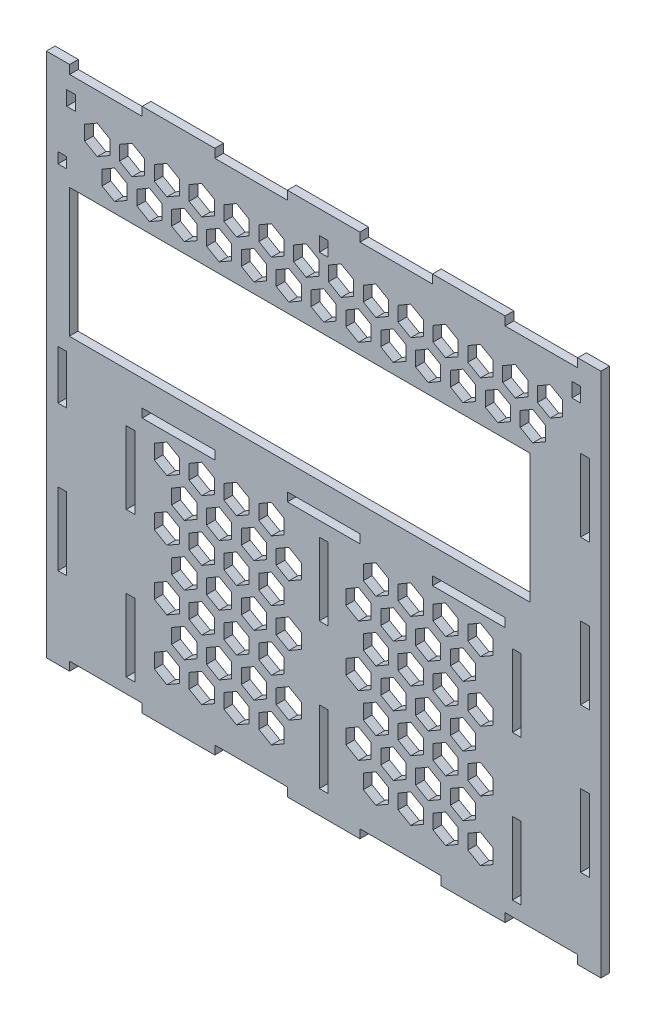
from build123d import *

# Parameters (mm, degrees)
SKICA1_W                      = 191
SKICA1_H                      = 175
P_IDAT_VYSUNUT_M1_DEPTH       = 3
SKICA2_W                      = 8
SKICA2_H                      = 3
SKICA2_W_2                    = 25
P_IDAT_VYSUNUT_M2_DEPTH       = 3
SKICA3_W                      = 3
SKICA3_H                      = 25
ODEBRAT_VYSUNUT_M1_DEPTH      = 132.60357138
SKICA4_W                      = 25
SKICA4_H                      = 3
ODEBRAT_VYSUNUT_M2_DEPTH      = 132.60357138
SKICA5_W                      = 158.75
SKICA5_H                      = 44.45
ODEBRAT_VYSUNUT_M3_DEPTH      = 132.60357138
SKICA8_W                      = 3
SKICA8_H                      = 5
ODEBRAT_VYSUNUT_M5_DEPTH      = 132.60357138
SKICA9_W                      = 3
SKICA9_H                      = 25
ODEBRAT_VYSUNUT_M6_DEPTH      = 132.60357138
SKICA10_W                     = 63.5
SKICA10_H                     = 80
P_IDAT_VYSUNUT_M3_DEPTH       = 10
POLE_VYPLN_N_M1_DEPTH         = 13
ODEBRAT_VYSUNUT_M7_DEPTH      = 133.210060132
ODEBRAT_VYSUNUT_M7_DEPTH_BACK = 133.210060132
SKICA11_W                     = 274.944841585
SKICA11_H                     = 28.480117971
SKICA12_W                     = 3
SKICA12_H                     = 21.33
SKICA12_H_2                   = 8.12
P_IDAT_VYSUNUT_M4_DEPTH       = 3
SKICA13_W                     = 3
SKICA13_H                     = 3
ODEBRAT_VYSUNUT_M8_DEPTH      = 132.60357138


# Read off the part's stored shape, not the designer's step: Pole vyplněním1
with BuildPart() as part:
    # Skica1 → Přidat vysunutím1 (new body)
    with BuildSketch(Plane.XY):
        Rectangle(SKICA1_W, SKICA1_H)
    extrude(amount=P_IDAT_VYSUNUT_M1_DEPTH)

    # Skica2 → Přidat vysunutím2 (add)
    with BuildSketch(Plane.XY):
        with Locations((-91.5, -89)):
            Rectangle(SKICA2_W, SKICA2_H)
        with Locations((-50, -89)):
            Rectangle(SKICA2_W_2, SKICA2_H)
        with Locations((0, -89)):
            Rectangle(SKICA2_W_2, SKICA2_H)
        with Locations((50, -89)):
            Rectangle(SKICA2_W_2, SKICA2_H)
        with Locations((91.5, -89)):
            Rectangle(SKICA2_W, SKICA2_H)
        with Locations((91.5, 89)):
            Rectangle(SKICA2_W, SKICA2_H)
        with Locations((50, 89)):
            Rectangle(SKICA2_W_2, SKICA2_H)
        with Locations((0, 89)):
            Rectangle(SKICA2_W_2, SKICA2_H)
        with Locations((-50, 89)):
            Rectangle(SKICA2_W_2, SKICA2_H)
        with Locations((-91.5, 89)):
            Rectangle(SKICA2_W, SKICA2_H)
    extrude(amount=P_IDAT_VYSUNUT_M2_DEPTH)

    # Skica3 → Odebrat vysunutím1 (cut, through all)
    with BuildSketch(Plane.XY):
        with Locations((0, -70)):
            Rectangle(SKICA3_W, SKICA3_H)
        with Locations((-66.5, -70)):
            Rectangle(SKICA3_W, SKICA3_H)
        with Locations((66.5, -70)):
            Rectangle(SKICA3_W, SKICA3_H)
        with Locations((0, -20)):
            Rectangle(SKICA3_W, SKICA3_H)
        with Locations((-66.5, -20)):
            Rectangle(SKICA3_W, SKICA3_H)
        with Locations((66.5, -20)):
            Rectangle(SKICA3_W, SKICA3_H)
    extrude(amount=ODEBRAT_VYSUNUT_M1_DEPTH, mode=Mode.SUBTRACT)

    # Skica4 → Odebrat vysunutím2 (cut, through all)
    with BuildSketch(Plane.XY):
        with Locations((-50, -1)):
            Rectangle(SKICA4_W, SKICA4_H)
        with Locations((0, -1)):
            Rectangle(SKICA4_W, SKICA4_H)
        with Locations((50, -1)):
            Rectangle(SKICA4_W, SKICA4_H)
    extrude(amount=ODEBRAT_VYSUNUT_M2_DEPTH, mode=Mode.SUBTRACT)

    # Skica5 → Odebrat vysunutím3 (cut, through all)
    with BuildSketch(Plane.XY):
        with Locations((-8.245, 31.605)):
            Rectangle(SKICA5_W, SKICA5_H)
    extrude(amount=ODEBRAT_VYSUNUT_M3_DEPTH, mode=Mode.SUBTRACT)

    # Skica8 → Odebrat vysunutím5 (cut, through all)
    with BuildSketch(Plane.XY):
        with Locations((-87, 80)):
            Rectangle(SKICA8_W, SKICA8_H)
        with Locations((0, 80)):
            Rectangle(SKICA8_W, SKICA8_H)
        with Locations((87, 80)):
            Rectangle(SKICA8_W, SKICA8_H)
    extrude(amount=ODEBRAT_VYSUNUT_M5_DEPTH, mode=Mode.SUBTRACT)

    # Skica9 → Odebrat vysunutím6 (cut, through all)
    with BuildSketch(Plane.XY):
        with Locations((-90, 50)):
            Rectangle(SKICA9_W, SKICA9_H)
        with Locations((-90, 0)):
            Rectangle(SKICA9_W, SKICA9_H)
        with Locations((-90, -50)):
            Rectangle(SKICA9_W, SKICA9_H)
        with Locations((90, -50)):
            Rectangle(SKICA9_W, SKICA9_H)
        with Locations((90, 0)):
            Rectangle(SKICA9_W, SKICA9_H)
        with Locations((90, 50)):
            Rectangle(SKICA9_W, SKICA9_H)
    extrude(amount=ODEBRAT_VYSUNUT_M6_DEPTH, mode=Mode.SUBTRACT)

    # Skica10 → Přidat vysunutím3 (add)
    with BuildSketch(Plane.XY.offset(3)):
        with Locations((-33.25, -42.5)):
            Rectangle(SKICA10_W, SKICA10_H)
        with Locations((33.25, -42.5)):
            Rectangle(SKICA10_W, SKICA10_H)
        Polygon((-85.5, 82.5), (-1.5, 82.5), (-1.5, 77.5), (1.5, 77.5), (1.5, 82.5), (85.5, 82.5), (85.5, 53.83), (-85.5, 53.83), align=None)
    extrude(amount=P_IDAT_VYSUNUT_M3_DEPTH)

    # Pole vyplněním1 outline → Pole vyplněním1 (cut)
    with BuildSketch(Plane.XY):
        Polygon((-73.669872981, 75.246133918), (-78, 77.746133918), (-82.330127019, 75.246133918), (-82.330127019, 70.246133918), (-78, 67.746133918), (-73.669872981, 70.246133918), align=None)
        Polygon((-55.669872981, 64.853829072), (-60, 67.353829072), (-64.330127019, 64.853829072), (-64.330127019, 59.853829072), (-60, 57.353829072), (-55.669872981, 59.853829072), align=None)
        Polygon((-67.669872981, 64.853829072), (-72, 67.353829072), (-76.330127019, 64.853829072), (-76.330127019, 59.853829072), (-72, 57.353829072), (-67.669872981, 59.853829072), align=None)
        Polygon((58.330127019, -7.892304845), (54, -5.392304845), (49.669872981, -7.892304845), (49.669872981, -12.892304845), (54, -15.392304845), (58.330127019, -12.892304845), align=None)
        Polygon((-54, 77.746133918), (-58.330127019, 75.246133918), (-58.330127019, 70.246133918), (-54, 67.746133918), (-49.669872981, 70.246133918), (-49.669872981, 75.246133918), align=None)
        Polygon((-42, 77.746133918), (-46.330127019, 75.246133918), (-46.330127019, 70.246133918), (-42, 67.746133918), (-37.669872981, 70.246133918), (-37.669872981, 75.246133918), align=None)
        Polygon((-43.669872981, 64.853829072), (-48, 67.353829072), (-52.330127019, 64.853829072), (-52.330127019, 59.853829072), (-48, 57.353829072), (-43.669872981, 59.853829072), align=None)
        Polygon((-61.669872981, 75.246133918), (-66, 77.746133918), (-70.330127019, 75.246133918), (-70.330127019, 70.246133918), (-66, 67.746133918), (-61.669872981, 70.246133918), align=None)
        Polygon((-30, 77.746133918), (-34.330127019, 75.246133918), (-34.330127019, 70.246133918), (-30, 67.746133918), (-25.669872981, 70.246133918), (-25.669872981, 75.246133918), align=None)
        Polygon((-52.330127019, -59.853829072), (-52.330127019, -64.853829072), (-48, -67.353829072), (-43.669872981, -64.853829072), (-43.669872981, -59.853829072), (-48, -57.353829072), align=None)
        Polygon((-52.330127019, -18.284609691), (-52.330127019, -23.284609691), (-48, -25.784609691), (-43.669872981, -23.284609691), (-43.669872981, -18.284609691), (-48, -15.784609691), align=None)
        Polygon((-52.330127019, -39.069219382), (-52.330127019, -44.069219382), (-48, -46.569219382), (-43.669872981, -44.069219382), (-43.669872981, -39.069219382), (-48, -36.569219382), align=None)
        Polygon((-31.669872981, 64.853829072), (-36, 67.353829072), (-40.330127019, 64.853829072), (-40.330127019, 59.853829072), (-36, 57.353829072), (-31.669872981, 59.853829072), align=None)
        Polygon((-18, 77.746133918), (-22.330127019, 75.246133918), (-22.330127019, 70.246133918), (-18, 67.746133918), (-13.669872981, 70.246133918), (-13.669872981, 75.246133918), align=None)
        Polygon((-40.330127019, -59.853829072), (-40.330127019, -64.853829072), (-36, -67.353829072), (-31.669872981, -64.853829072), (-31.669872981, -59.853829072), (-36, -57.353829072), align=None)
        Polygon((-40.330127019, -39.069219382), (-40.330127019, -44.069219382), (-36, -46.569219382), (-31.669872981, -44.069219382), (-31.669872981, -39.069219382), (-36, -36.569219382), align=None)
        Polygon((-40.330127019, -18.284609691), (-40.330127019, -23.284609691), (-36, -25.784609691), (-31.669872981, -23.284609691), (-31.669872981, -18.284609691), (-36, -15.784609691), align=None)
        Polygon((-49.669872981, -70.246133918), (-54, -67.746133918), (-58.330127019, -70.246133918), (-58.330127019, -75.246133918), (-54, -77.746133918), (-49.669872981, -75.246133918), align=None)
        Polygon((-18, -46.961524227), (-22.330127019, -49.461524227), (-22.330127019, -54.461524227), (-18, -56.961524227), (-13.669872981, -54.461524227), (-13.669872981, -49.461524227), align=None)
        Polygon((18, -26.176914536), (13.669872981, -28.676914536), (13.669872981, -33.676914536), (18, -36.176914536), (22.330127019, -33.676914536), (22.330127019, -28.676914536), align=None)
        Polygon((36, -15.784609691), (31.669872981, -18.284609691), (31.669872981, -23.284609691), (36, -25.784609691), (40.330127019, -23.284609691), (40.330127019, -18.284609691), align=None)
        Polygon((-58.330127019, -7.892304845), (-58.330127019, -12.892304845), (-54, -15.392304845), (-49.669872981, -12.892304845), (-49.669872981, -7.892304845), (-54, -5.392304845), align=None)
        Polygon((-58.330127019, -28.676914536), (-58.330127019, -33.676914536), (-54, -36.176914536), (-49.669872981, -33.676914536), (-49.669872981, -28.676914536), (-54, -26.176914536), align=None)
        Polygon((-58.330127019, -49.461524227), (-58.330127019, -54.461524227), (-54, -56.961524227), (-49.669872981, -54.461524227), (-49.669872981, -49.461524227), (-54, -46.961524227), align=None)
        Polygon((-37.669872981, -70.246133918), (-42, -67.746133918), (-46.330127019, -70.246133918), (-46.330127019, -75.246133918), (-42, -77.746133918), (-37.669872981, -75.246133918), align=None)
        Polygon((-24, -57.353829072), (-28.330127019, -59.853829072), (-28.330127019, -64.853829072), (-24, -67.353829072), (-19.669872981, -64.853829072), (-19.669872981, -59.853829072), align=None)
        Polygon((12, -36.569219382), (7.669872981, -39.069219382), (7.669872981, -44.069219382), (12, -46.569219382), (16.330127019, -44.069219382), (16.330127019, -39.069219382), align=None)
        Polygon((30, -26.176914536), (25.669872981, -28.676914536), (25.669872981, -33.676914536), (30, -36.176914536), (34.330127019, -33.676914536), (34.330127019, -28.676914536), align=None)
        Polygon((48, -15.784609691), (43.669872981, -18.284609691), (43.669872981, -23.284609691), (48, -25.784609691), (52.330127019, -23.284609691), (52.330127019, -18.284609691), align=None)
        Polygon((-46.330127019, -49.461524227), (-46.330127019, -54.461524227), (-42, -56.961524227), (-37.669872981, -54.461524227), (-37.669872981, -49.461524227), (-42, -46.961524227), align=None)
        Polygon((-46.330127019, -7.892304845), (-46.330127019, -12.892304845), (-42, -15.392304845), (-37.669872981, -12.892304845), (-37.669872981, -7.892304845), (-42, -5.392304845), align=None)
        Polygon((-46.330127019, -28.676914536), (-46.330127019, -33.676914536), (-42, -36.176914536), (-37.669872981, -33.676914536), (-37.669872981, -28.676914536), (-42, -26.176914536), align=None)
        Polygon((-25.669872981, -70.246133918), (-30, -67.746133918), (-34.330127019, -70.246133918), (-34.330127019, -75.246133918), (-30, -77.746133918), (-25.669872981, -75.246133918), align=None)
        Polygon((-12, -57.353829072), (-16.330127019, -59.853829072), (-16.330127019, -64.853829072), (-12, -67.353829072), (-7.669872981, -64.853829072), (-7.669872981, -59.853829072), align=None)
        Polygon((24, -36.569219382), (19.669872981, -39.069219382), (19.669872981, -44.069219382), (24, -46.569219382), (28.330127019, -44.069219382), (28.330127019, -39.069219382), align=None)
        Polygon((42, -26.176914536), (37.669872981, -28.676914536), (37.669872981, -33.676914536), (42, -36.176914536), (46.330127019, -33.676914536), (46.330127019, -28.676914536), align=None)
        Polygon((-34.330127019, -49.461524227), (-34.330127019, -54.461524227), (-30, -56.961524227), (-25.669872981, -54.461524227), (-25.669872981, -49.461524227), (-30, -46.961524227), align=None)
        Polygon((-34.330127019, -28.676914536), (-34.330127019, -33.676914536), (-30, -36.176914536), (-25.669872981, -33.676914536), (-25.669872981, -28.676914536), (-30, -26.176914536), align=None)
        Polygon((-34.330127019, -7.892304845), (-34.330127019, -12.892304845), (-30, -15.392304845), (-25.669872981, -12.892304845), (-25.669872981, -7.892304845), (-30, -5.392304845), align=None)
        Polygon((-13.669872981, -70.246133918), (-18, -67.746133918), (-22.330127019, -70.246133918), (-22.330127019, -75.246133918), (-18, -77.746133918), (-13.669872981, -75.246133918), align=None)
        Polygon((18, -46.961524227), (13.669872981, -49.461524227), (13.669872981, -54.461524227), (18, -56.961524227), (22.330127019, -54.461524227), (22.330127019, -49.461524227), align=None)
        Polygon((36, -36.569219382), (31.669872981, -39.069219382), (31.669872981, -44.069219382), (36, -46.569219382), (40.330127019, -44.069219382), (40.330127019, -39.069219382), align=None)
        Polygon((54, -26.176914536), (49.669872981, -28.676914536), (49.669872981, -33.676914536), (54, -36.176914536), (58.330127019, -33.676914536), (58.330127019, -28.676914536), align=None)
        Polygon((-22.330127019, -28.676914536), (-22.330127019, -33.676914536), (-18, -36.176914536), (-13.669872981, -33.676914536), (-13.669872981, -28.676914536), (-18, -26.176914536), align=None)
        Polygon((-22.330127019, -7.892304845), (-22.330127019, -12.892304845), (-18, -15.392304845), (-13.669872981, -12.892304845), (-13.669872981, -7.892304845), (-18, -5.392304845), align=None)
        Polygon((22.330127019, -70.246133918), (18, -67.746133918), (13.669872981, -70.246133918), (13.669872981, -75.246133918), (18, -77.746133918), (22.330127019, -75.246133918), align=None)
        Polygon((36, -57.353829072), (31.669872981, -59.853829072), (31.669872981, -64.853829072), (36, -67.353829072), (40.330127019, -64.853829072), (40.330127019, -59.853829072), align=None)
        Polygon((54, -46.961524227), (49.669872981, -49.461524227), (49.669872981, -54.461524227), (54, -56.961524227), (58.330127019, -54.461524227), (58.330127019, -49.461524227), align=None)
        Polygon((13.669872981, -7.892304845), (13.669872981, -12.892304845), (18, -15.392304845), (22.330127019, -12.892304845), (22.330127019, -7.892304845), (18, -5.392304845), align=None)
        Polygon((13.669872981, 75.246133918), (13.669872981, 70.246133918), (18, 67.746133918), (22.330127019, 70.246133918), (22.330127019, 75.246133918), (18, 77.746133918), align=None)
        Polygon((34.330127019, -70.246133918), (30, -67.746133918), (25.669872981, -70.246133918), (25.669872981, -75.246133918), (30, -77.746133918), (34.330127019, -75.246133918), align=None)
        Polygon((16.330127019, -59.853829072), (12, -57.353829072), (7.669872981, -59.853829072), (7.669872981, -64.853829072), (12, -67.353829072), (16.330127019, -64.853829072), align=None)
        Polygon((-19.669872981, -39.069219382), (-24, -36.569219382), (-28.330127019, -39.069219382), (-28.330127019, -44.069219382), (-24, -46.569219382), (-19.669872981, -44.069219382), align=None)
        Polygon((48, -57.353829072), (43.669872981, -59.853829072), (43.669872981, -64.853829072), (48, -67.353829072), (52.330127019, -64.853829072), (52.330127019, -59.853829072), align=None)
        Polygon((25.669872981, -49.461524227), (25.669872981, -54.461524227), (30, -56.961524227), (34.330127019, -54.461524227), (34.330127019, -49.461524227), (30, -46.961524227), align=None)
        Polygon((25.669872981, -7.892304845), (25.669872981, -12.892304845), (30, -15.392304845), (34.330127019, -12.892304845), (34.330127019, -7.892304845), (30, -5.392304845), align=None)
        Polygon((25.669872981, 75.246133918), (25.669872981, 70.246133918), (30, 67.746133918), (34.330127019, 70.246133918), (34.330127019, 75.246133918), (30, 77.746133918), align=None)
        Polygon((46.330127019, -70.246133918), (42, -67.746133918), (37.669872981, -70.246133918), (37.669872981, -75.246133918), (42, -77.746133918), (46.330127019, -75.246133918), align=None)
        Polygon((28.330127019, -59.853829072), (24, -57.353829072), (19.669872981, -59.853829072), (19.669872981, -64.853829072), (24, -67.353829072), (28.330127019, -64.853829072), align=None)
        Polygon((-7.669872981, -39.069219382), (-12, -36.569219382), (-16.330127019, -39.069219382), (-16.330127019, -44.069219382), (-12, -46.569219382), (-7.669872981, -44.069219382), align=None)
        Polygon((37.669872981, -49.461524227), (37.669872981, -54.461524227), (42, -56.961524227), (46.330127019, -54.461524227), (46.330127019, -49.461524227), (42, -46.961524227), align=None)
        Polygon((37.669872981, -7.892304845), (37.669872981, -12.892304845), (42, -15.392304845), (46.330127019, -12.892304845), (46.330127019, -7.892304845), (42, -5.392304845), align=None)
        Polygon((37.669872981, 75.246133918), (37.669872981, 70.246133918), (42, 67.746133918), (46.330127019, 70.246133918), (46.330127019, 75.246133918), (42, 77.746133918), align=None)
        Polygon((58.330127019, -70.246133918), (54, -67.746133918), (49.669872981, -70.246133918), (49.669872981, -75.246133918), (54, -77.746133918), (58.330127019, -75.246133918), align=None)
        Polygon((49.669872981, 75.246133918), (49.669872981, 70.246133918), (54, 67.746133918), (58.330127019, 70.246133918), (58.330127019, 75.246133918), (54, 77.746133918), align=None)
        Polygon((-19.669872981, 64.853829072), (-24, 67.353829072), (-28.330127019, 64.853829072), (-28.330127019, 59.853829072), (-24, 57.353829072), (-19.669872981, 59.853829072), align=None)
        Polygon((-7.669872981, 64.853829072), (-12, 67.353829072), (-16.330127019, 64.853829072), (-16.330127019, 59.853829072), (-12, 57.353829072), (-7.669872981, 59.853829072), align=None)
        Polygon((72, 67.353829072), (67.669872981, 64.853829072), (67.669872981, 59.853829072), (72, 57.353829072), (76.330127019, 59.853829072), (76.330127019, 64.853829072), align=None)
        Polygon((24, -15.784609691), (19.669872981, -18.284609691), (19.669872981, -23.284609691), (24, -25.784609691), (28.330127019, -23.284609691), (28.330127019, -18.284609691), align=None)
        Polygon((-28.330127019, -18.284609691), (-28.330127019, -23.284609691), (-24, -25.784609691), (-19.669872981, -23.284609691), (-19.669872981, -18.284609691), (-24, -15.784609691), align=None)
        Polygon((-16.330127019, -18.284609691), (-16.330127019, -23.284609691), (-12, -25.784609691), (-7.669872981, -23.284609691), (-7.669872981, -18.284609691), (-12, -15.784609691), align=None)
        Polygon((48, -36.569219382), (43.669872981, -39.069219382), (43.669872981, -44.069219382), (48, -46.569219382), (52.330127019, -44.069219382), (52.330127019, -39.069219382), align=None)
        Polygon((7.669872981, -18.284609691), (7.669872981, -23.284609691), (12, -25.784609691), (16.330127019, -23.284609691), (16.330127019, -18.284609691), (12, -15.784609691), align=None)
        Polygon((7.669872981, 64.853829072), (7.669872981, 59.853829072), (12, 57.353829072), (16.330127019, 59.853829072), (16.330127019, 64.853829072), (12, 67.353829072), align=None)
        Polygon((19.669872981, 64.853829072), (19.669872981, 59.853829072), (24, 57.353829072), (28.330127019, 59.853829072), (28.330127019, 64.853829072), (24, 67.353829072), align=None)
        Polygon((31.669872981, 64.853829072), (31.669872981, 59.853829072), (36, 57.353829072), (40.330127019, 59.853829072), (40.330127019, 64.853829072), (36, 67.353829072), align=None)
        Polygon((43.669872981, 64.853829072), (43.669872981, 59.853829072), (48, 57.353829072), (52.330127019, 59.853829072), (52.330127019, 64.853829072), (48, 67.353829072), align=None)
        Polygon((-6, 77.746133918), (-10.330127019, 75.246133918), (-10.330127019, 70.246133918), (-6, 67.746133918), (-1.669872981, 70.246133918), (-1.669872981, 75.246133918), align=None)
        Polygon((4.330127019, 64.853829072), (0, 67.353829072), (-4.330127019, 64.853829072), (-4.330127019, 59.853829072), (0, 57.353829072), (4.330127019, 59.853829072), align=None)
        Polygon((6, 77.746133918), (1.669872981, 75.246133918), (1.669872981, 70.246133918), (6, 67.746133918), (10.330127019, 70.246133918), (10.330127019, 75.246133918), align=None)
        Polygon((66, 77.746133918), (61.669872981, 75.246133918), (61.669872981, 70.246133918), (66, 67.746133918), (70.330127019, 70.246133918), (70.330127019, 75.246133918), align=None)
        Polygon((64.330127019, 64.853829072), (60, 67.353829072), (55.669872981, 64.853829072), (55.669872981, 59.853829072), (60, 57.353829072), (64.330127019, 59.853829072), align=None)
        Polygon((78, 77.746133918), (73.669872981, 75.246133918), (73.669872981, 70.246133918), (78, 67.746133918), (82.330127019, 70.246133918), (82.330127019, 75.246133918), align=None)
    extrude(amount=POLE_VYPLN_N_M1_DEPTH, mode=Mode.SUBTRACT)

    # Skica11 → Odebrat vysunutím7 (cut, two sides: drawn at the far end of the back side and taken through both)
    with BuildSketch(Plane(origin=(0, 0, 0), x_dir=(1, 0, 0), z_dir=(0, 1, 0)).offset(-ODEBRAT_VYSUNUT_M7_DEPTH_BACK)):
        with Locations((10.449210131, -17.240058985)):
            Rectangle(SKICA11_W, SKICA11_H)
    extrude(amount=ODEBRAT_VYSUNUT_M7_DEPTH + ODEBRAT_VYSUNUT_M7_DEPTH_BACK, mode=Mode.SUBTRACT)

    # Skica12 → Přidat vysunutím4 (add)
    with BuildSketch(Plane.XY):
        with Locations((-90, 48.165)):
            Rectangle(SKICA12_W, SKICA12_H)
        with Locations((-90, 8.44)):
            Rectangle(SKICA12_W, SKICA12_H_2)
    extrude(amount=P_IDAT_VYSUNUT_M4_DEPTH)

    # Skica13 → Odebrat vysunutím8 (cut, through all)
    with BuildSketch(Plane.XY):
        with Locations((39, -89)):
            Rectangle(SKICA13_W, SKICA13_H)
    extrude(amount=ODEBRAT_VYSUNUT_M8_DEPTH, mode=Mode.SUBTRACT)


solid = part.part
